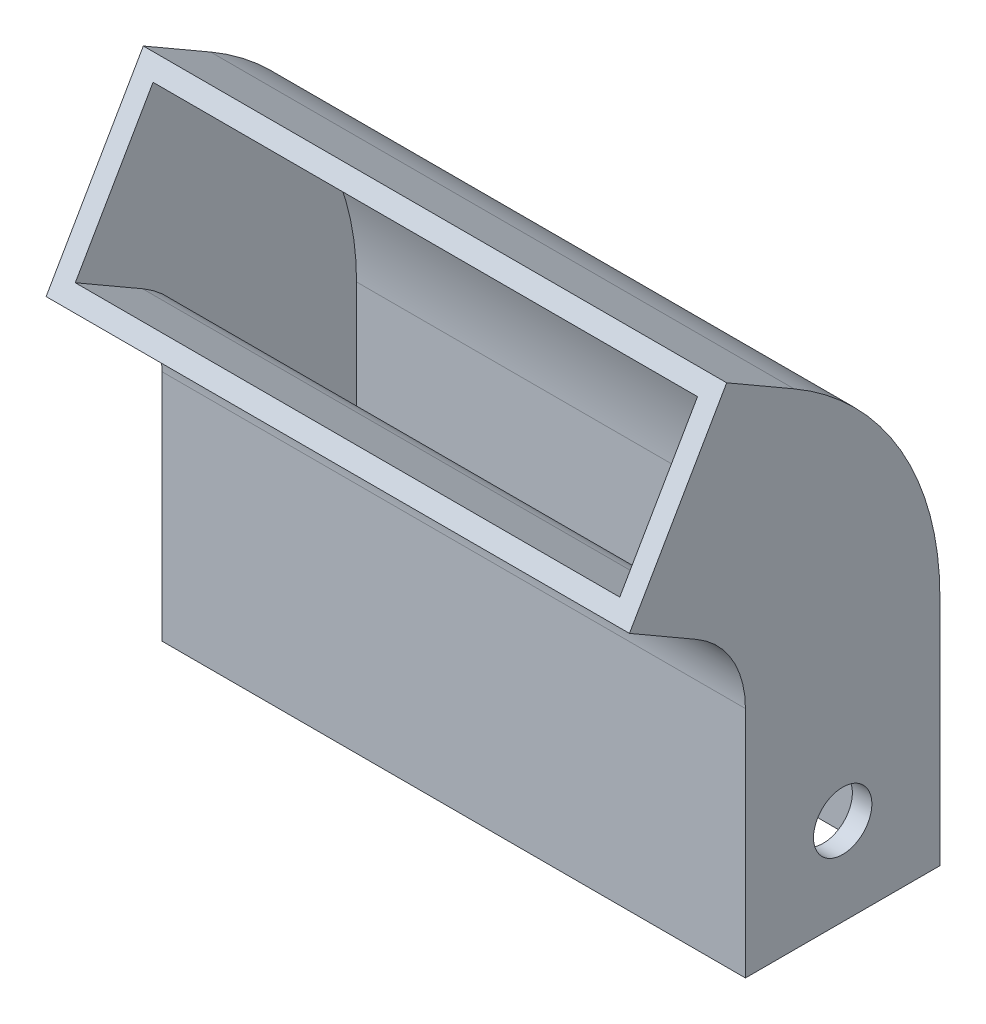
from build123d import *

# Parameters (mm, degrees)
SKETCH1_W           = 30
SKETCH1_H           = 10
SKETCH1_W_2         = 28
SKETCH1_H_2         = 8
BOSS_EXTRUDE1_DEPTH = 12
SWEEP1_START        = -15
SWEEP1_DEPTH        = 30
SWEEP1_2_DEPTH      = 1
SWEEP1_START_2      = 14
SWEEP1_3_DEPTH      = 1
SKETCH4_W           = 30
SKETCH4_H           = 10
SKETCH4_W_2         = 28
SKETCH4_H_2         = 8
BOSS_EXTRUDE2_DEPTH = 4
SKETCH7_R           = 1.5
CUT_EXTRUDE1_DEPTH  = 42.817367132


# Read off the part's stored shape, not the designer's step: Sweep1
with BuildPart() as part:
    # Sketch1 → Boss-Extrude1 (new body)
    with BuildSketch(Plane(origin=(0, 0, 0), x_dir=(1, 0, 0), z_dir=(0, 1, 0))):
        Rectangle(SKETCH1_W, SKETCH1_H)
        Rectangle(SKETCH1_W_2, SKETCH1_H_2, mode=Mode.SUBTRACT)
    extrude(amount=BOSS_EXTRUDE1_DEPTH)

    # Sweep1 outline → Sweep1 (add)
    with BuildSketch(Plane.YZ.offset(SWEEP1_START)):
        with BuildLine():
            ThreePointArc((16.330127019, 7.5), (14.5, 5.669872981), (12, 5))
            Line((12, 5), (12, 4))
            ThreePointArc((12, 4), (15, 4.803847577), (17.196152423, 7))
            Line((17.196152423, 7), (16.330127019, 7.5))
        make_face()
        with BuildLine():
            ThreePointArc((24.124355653, 3), (19, -2.124355653), (12, -4))
            Line((12, -4), (12, -5))
            ThreePointArc((12, -5), (19.5, -2.990381057), (24.990381057, 2.5))
            Line((24.990381057, 2.5), (24.124355653, 3))
        make_face()
    extrude(amount=SWEEP1_DEPTH)

    # Sweep1 2 outline → Sweep1 2 (add)
    with BuildSketch(Plane.YZ.offset(SWEEP1_START)):
        with BuildLine():
            ThreePointArc((17.196152423, 7), (15, 4.803847577), (12, 4))
            Line((12, 4), (12, -4))
            ThreePointArc((12, -4), (19, -2.124355653), (24.124355653, 3))
            Line((24.124355653, 3), (17.196152423, 7))
        make_face()
    extrude(amount=SWEEP1_2_DEPTH)

    # Sweep1 3 outline → Sweep1 3 (add)
    with BuildSketch(Plane.YZ.offset(SWEEP1_START_2)):
        with BuildLine():
            ThreePointArc((17.196152423, 7), (15, 4.803847577), (12, 4))
            Line((12, 4), (12, -4))
            ThreePointArc((12, -4), (19, -2.124355653), (24.124355653, 3))
            Line((24.124355653, 3), (17.196152423, 7))
        make_face()
    extrude(amount=SWEEP1_3_DEPTH)

    # Sketch4 → Boss-Extrude2 (add)
    with BuildSketch(Plane(origin=(0, 7.330127019, 12.696152423), x_dir=(1, 0, 0), z_dir=(0, 0.4999999999999947, 0.8660254037844418))):
        with Locations((0, 15.392304845)):
            Rectangle(SKETCH4_W, SKETCH4_H)
        with Locations((0, 15.392304845)):
            Rectangle(SKETCH4_W_2, SKETCH4_H_2, mode=Mode.SUBTRACT)
    extrude(amount=BOSS_EXTRUDE2_DEPTH)

    # Sketch7 → Cut-Extrude1 (cut, through all)
    with BuildSketch(Plane.ZY.offset(15)):
        with Locations((0, 4.5)):
            Circle(SKETCH7_R)
    extrude(amount=-CUT_EXTRUDE1_DEPTH, mode=Mode.SUBTRACT)


solid = part.part
